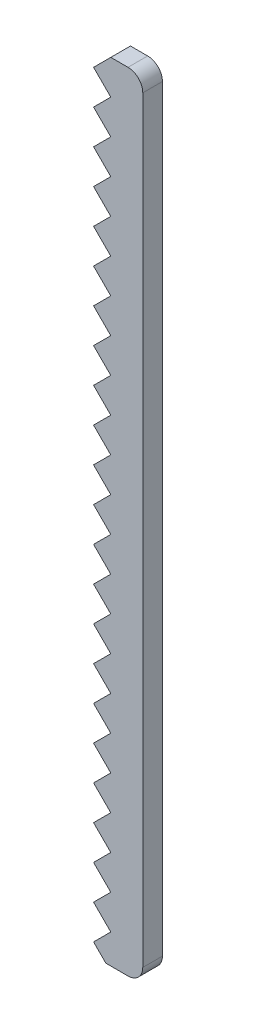
from build123d import *

# Parameters (mm, degrees)
BOSS_EXTRUDE1_DEPTH = 2
CUT_EXTRUDE4_START  = -2
CUT_EXTRUDE4_DEPTH  = 2


# Read off the part's stored shape, not the designer's step: Cut-Extrude4
with BuildPart() as part:
    # Sketch1 → Boss-Extrude1 (new body)
    with BuildSketch(Plane.XY):
        with BuildLine():
            Line((0, 76.134146341), (0, -0.865853659))
            ThreePointArc((0, -0.865853659), (-0.439339828, -1.92651383), (-1.5, -2.365853659))
            Line((-1.5, -2.365853659), (-5, -2.365853659))
            Line((-5, -2.365853659), (-5, 77.634146341))
            Line((-5, 77.634146341), (-1.5, 77.634146341))
            ThreePointArc((-1.5, 77.634146341), (-0.439339828, 77.194806513), (0, 76.134146341))
        make_face()
    extrude(amount=BOSS_EXTRUDE1_DEPTH)

    # Cut-Extrude4 outline → Cut-Extrude4 (cut)
    with BuildSketch(Plane.XY.offset(2).offset(CUT_EXTRUDE4_START)):
        Polygon((-5, 77.634146341), (-5, 75.884146341), (-3.25, 77.634146341), align=None)
        Polygon((-3.75, -2.365853659), (-5, -1.115853659), (-5, -2.365853659), align=None)
        Polygon((-3.25, 0.634146341), (-5, 2.384146341), (-5, -1.115853659), align=None)
        Polygon((-3.25, 4.134146341), (-5, 5.884146341), (-5, 2.384146341), align=None)
        Polygon((-3.25, 7.634146341), (-5, 9.384146341), (-5, 5.884146341), align=None)
        Polygon((-3.25, 11.134146341), (-5, 12.884146341), (-5, 9.384146341), align=None)
        Polygon((-3.25, 14.634146341), (-5, 16.384146341), (-5, 12.884146341), align=None)
        Polygon((-3.25, 18.134146341), (-5, 19.884146341), (-5, 16.384146341), align=None)
        Polygon((-3.25, 21.634146341), (-5, 23.384146341), (-5, 19.884146341), align=None)
        Polygon((-3.25, 25.134146341), (-5, 26.884146341), (-5, 23.384146341), align=None)
        Polygon((-3.25, 28.634146341), (-5, 30.384146341), (-5, 26.884146341), align=None)
        Polygon((-3.25, 32.134146341), (-5, 33.884146341), (-5, 30.384146341), align=None)
        Polygon((-3.25, 35.634146341), (-5, 37.384146341), (-5, 33.884146341), align=None)
        Polygon((-3.25, 39.134146341), (-5, 40.884146341), (-5, 37.384146341), align=None)
        Polygon((-3.25, 42.634146341), (-5, 44.384146341), (-5, 40.884146341), align=None)
        Polygon((-3.25, 46.134146341), (-5, 47.884146341), (-5, 44.384146341), align=None)
        Polygon((-3.25, 49.634146341), (-5, 51.384146341), (-5, 47.884146341), align=None)
        Polygon((-3.25, 53.134146341), (-5, 54.884146341), (-5, 51.384146341), align=None)
        Polygon((-3.25, 56.634146341), (-5, 58.384146341), (-5, 54.884146341), align=None)
        Polygon((-3.25, 60.134146341), (-5, 61.884146341), (-5, 58.384146341), align=None)
        Polygon((-3.25, 63.634146341), (-5, 65.384146341), (-5, 61.884146341), align=None)
        Polygon((-3.25, 67.134146341), (-5, 68.884146341), (-5, 65.384146341), align=None)
        Polygon((-3.25, 70.634146341), (-5, 72.384146341), (-5, 68.884146341), align=None)
        Polygon((-3.25, 74.134146341), (-5, 75.884146341), (-5, 72.384146341), align=None)
    extrude(amount=CUT_EXTRUDE4_DEPTH, mode=Mode.SUBTRACT)


solid = part.part
